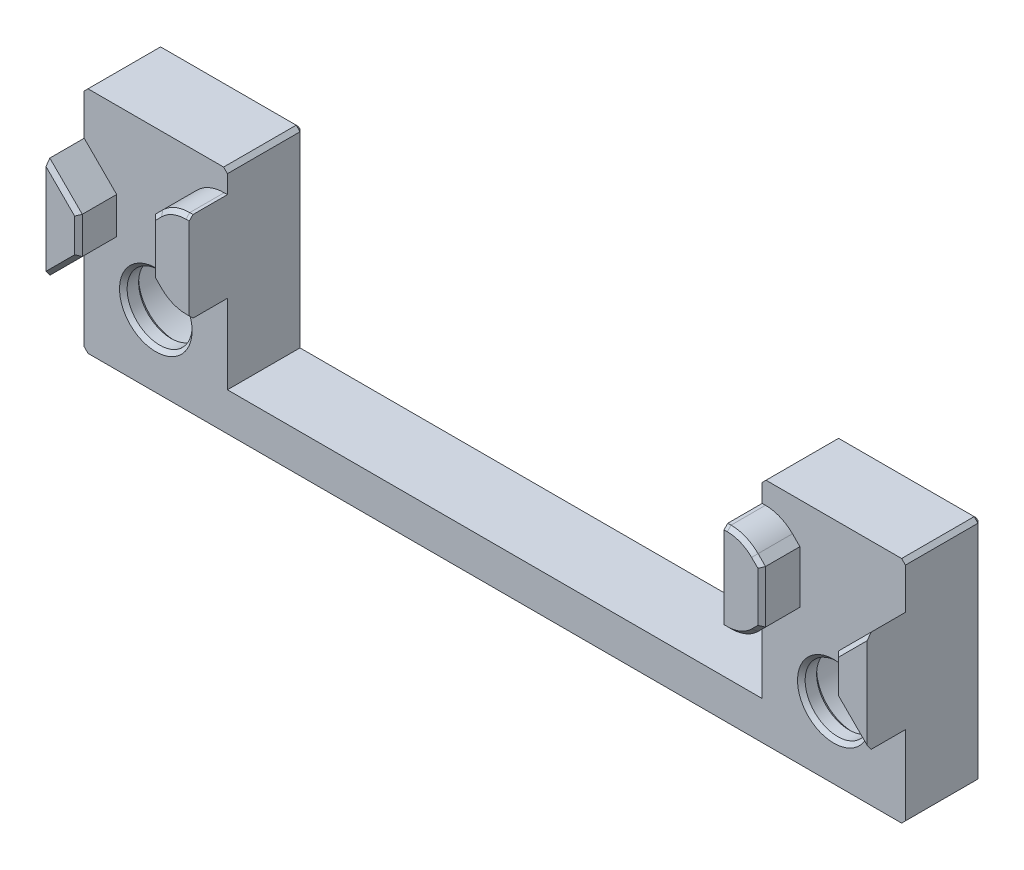
from build123d import *

# Parameters (mm, degrees)
BOSS_EXTRUDE1_DEPTH            = 4
SLOT_ALIGNER_DEPTH             = 2
ALIGNER_DEPTH                  = 2
DEBURS_SIZE                    = 0.2
CBORE_FOR_M3_SHCS1_D           = 3.4
CBORE_FOR_M3_SHCS1_CBORE_D     = 6.5
CBORE_FOR_M3_SHCS1_CBORE_DEPTH = 3
CHAMFER1_SIZE                  = 0.2


with BuildPart() as part:
    # Sketch1 → Boss-Extrude1 (new body)
    with BuildSketch(Plane.XY):
        Polygon((-21.3, -6), (21.3, -6), (21.5, -5.8), (21.5, 5.8), (21.3, 6), (14.2, 6), (14, 5.8), (14, -4), (-14, -4), (-14, 5.8), (-14.2, 6), (-21.3, 6), (-21.5, 5.8), (-21.5, -5.8), align=None)
    extrude(amount=-BOSS_EXTRUDE1_DEPTH)

    # Sketch3 → Slot Aligner (add)
    with BuildSketch(Plane.XY):
        with BuildLine():
            Line((14.171572875, 4.85), (14, 4.85))
            Line((14, 4.85), (14, 0.15))
            Line((14, 0.15), (14.171572875, 0.15))
            ThreePointArc((14.171572875, 0.15), (14.93693974, 0.302240935), (15.585786438, 0.735786438))
            Line((15.585786438, 0.735786438), (15.975, 1.125))
            Line((15.975, 1.125), (15.975, 3.875))
            Line((15.975, 3.875), (15.585786438, 4.264213562))
            ThreePointArc((15.585786438, 4.264213562), (14.93693974, 4.697759065), (14.171572875, 4.85))
        make_face()
    slot_aligner = extrude(amount=SLOT_ALIGNER_DEPTH)

    # Mirror3: Slot Aligner across plane
    add(slot_aligner.mirror(Plane(origin=(0, 0, 0), x_dir=(0, 0, 1), z_dir=(1, 0, 0))))

    # Sketch4 → Aligner (add)
    with BuildSketch(Plane.XY):
        Polygon((21.4, 3.558578644), (21.5, 3.658578644), (21.5, -1.658578644), (21.4, -1.558578644), (19.8, 0.041421356), (19.8, 1.958578644), align=None)
    aligner = extrude(amount=ALIGNER_DEPTH)

    # Aligners: Aligner across plane
    add(aligner.mirror(Plane(origin=(0, 0, 0), x_dir=(0, 0, 1), z_dir=(1, 0, 0))))

    # Deburs
    deburs_edges = [part.edges().sort_by_distance(p)[0] for p in [
        (14, 0.9, -4),
        (14.1, 5.9, -4),
        (17.75, 6, -4),
        (21.4, 5.9, -4),
        (21.5, 0, -4),
        (21.4, -5.9, -4),
        (0, -6, -4),
        (-21.4, -5.9, -4),
        (-21.5, 0, -4),
        (-21.4, 5.9, -4),
        (-17.75, 6, -4),
        (-14.1, 5.9, -4),
        (-14, 0.9, -4),
        (0, -4, -4),
        (-20.65, 2.808578644, 2),
        (-20.65, -0.808578644, 2),
        (-19.8, 1, 2),
        (20.65, -0.808578644, 2),
        (19.8, 1, 2),
        (20.65, 2.808578644, 2),
        (-14.085786438, 4.85, 2),
        (-14.085786438, 0.15, 2),
        (-14.93693974, 4.697759065, 2),
        (-14.93693974, 0.302240935, 2),
        (-15.780393219, 4.069606781, 2),
        (-15.780393219, 0.930393219, 2),
        (-15.975, 2.5, 2),
        (14.085786438, 4.85, 2),
        (14.085786438, 0.15, 2),
        (14.93693974, 4.697759065, 2),
        (14.93693974, 0.302240935, 2),
        (15.780393219, 4.069606781, 2),
        (15.975, 2.5, 2),
        (15.780393219, 0.930393219, 2),
    ]]
    chamfer(deburs_edges, length=DEBURS_SIZE)

    # CBORE for M3 SHCS1 (through all)
    with Locations(Plane(origin=(0, 0, -4), x_dir=(-1, 0, 0), z_dir=(0, 0, -1))):
        with Locations((-17.75, -2.25), (17.75, -2.25)):
            CounterBoreHole(CBORE_FOR_M3_SHCS1_D / 2, CBORE_FOR_M3_SHCS1_CBORE_D / 2, CBORE_FOR_M3_SHCS1_CBORE_DEPTH)

    # Chamfer1
    chamfer1_edges = [part.edges().sort_by_distance(p)[0] for p in [
        (-19.45, -2.25, 0),
        (-19.45, -2.25, -1),
        (16.05, -2.25, 0),
        (16.05, -2.25, -1),
        (21, -2.25, -4),
        (-14.5, -2.25, -4),
    ]]
    chamfer(chamfer1_edges, length=CHAMFER1_SIZE)


solid = part.part
